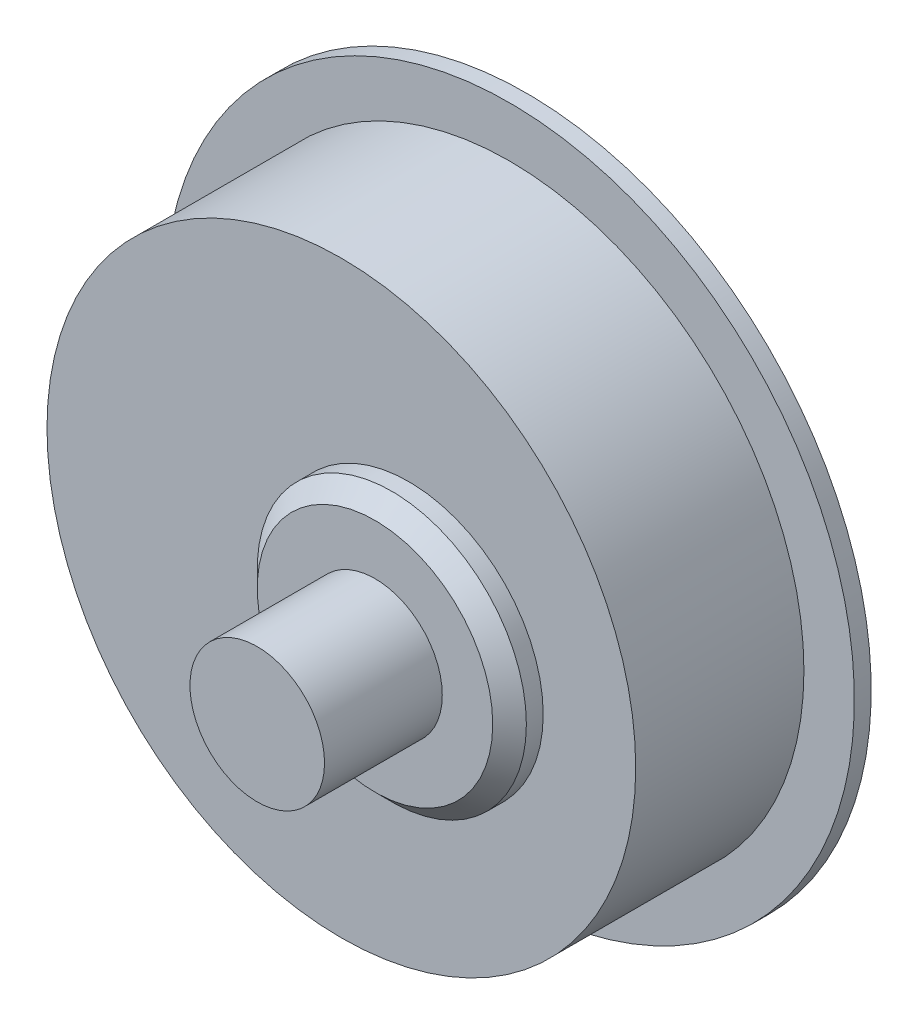
from build123d import *
from build123d.topology import SkipClean

# Parameters (mm, degrees)
SKETCH1_R               = 17.5
BOSS_EXTRUDE1_DEPTH     = 5
SKETCH3_R               = 20.5
SKETCH3_R_2             = 17.5
BOSS_EXTRUDE3_DEPTH     = 1
BOSS_EXTRUDE2_OUTLINE_R = 7.5
BOSS_EXTRUDE2_DEPTH     = 0.5
SKETCH4_R               = 8
BOSS_EXTRUDE5_DEPTH     = 2
BOSS_EXTRUDE6_START     = 7
SKETCH5_R               = 4
BOSS_EXTRUDE6_DEPTH     = 7
CHAMFER1_SIZE           = 1


# Read off the part's stored shape, not the designer's step: Boss-Extrude2
with BuildPart() as part:
    # Sketch1 → Boss-Extrude1 (new, symmetric)
    with BuildSketch(Plane.XY):
        with Locations((-4, 0)):
            Circle(SKETCH1_R)
        with BuildLine():
            Line((1.5, 3.708099244), (1.5, -3.708099244))
            ThreePointArc((1.5, -3.708099244), (-4, 0), (1.5, 3.708099244))
        make_face(mode=Mode.SUBTRACT)
    extrude(amount=BOSS_EXTRUDE1_DEPTH, both=True)

    # Sketch3 → Boss-Extrude3 (add)
    # profile 1 of 2: a face of its own
    with SkipClean():  # the faces are left unmerged after this step: merging them gives an invalid solid
        with BuildSketch(Plane(origin=(0, 0, -5), x_dir=(-1, 0, 0), z_dir=(0, 0, -1))):
            with Locations((4, 0)):
                Circle(SKETCH3_R)
            with Locations(Location((4, 0, 0), (0, 0, 180))):
                Circle(SKETCH3_R_2, mode=Mode.SUBTRACT)
        # profile 2 of 2: a face of its own
        with BuildSketch(Plane(origin=(0, 0, -5), x_dir=(-1, 0, 0), z_dir=(0, 0, -1))):
            with Locations(Location((4, 0, 0), (0, 0, 180))):
                Circle(SKETCH3_R_2)
            with BuildLine():
                Line((-1.5, -3.708099244), (-1.5, 3.708099244))
                ThreePointArc((-1.5, 3.708099244), (4, 0), (-1.5, -3.708099244))
            make_face(mode=Mode.SUBTRACT)
        extrude(amount=BOSS_EXTRUDE3_DEPTH)

    # Boss-Extrude2 outline → Boss-Extrude2 (add)
    with SkipClean():  # the faces are left unmerged after this step: merging them gives an invalid solid
        with BuildSketch(Plane(origin=(0, 0, -6), x_dir=(-1, 0, 0), z_dir=(0, 0, -1))):
            Circle(BOSS_EXTRUDE2_OUTLINE_R)
            with BuildLine():
                ThreePointArc((-1.5, 3.708099244), (4, 0), (-1.5, -3.708099244))
                Line((-1.5, -3.708099244), (-1.5, 3.708099244))
            make_face(mode=Mode.SUBTRACT)
        extrude(amount=BOSS_EXTRUDE2_DEPTH)

    # Sketch4 → Boss-Extrude5 (add)
    with SkipClean():  # the faces are left unmerged after this step: merging them gives an invalid solid
        with BuildSketch(Plane.XY.offset(5)):
            Circle(SKETCH4_R)
        extrude(amount=BOSS_EXTRUDE5_DEPTH)

    # Sketch5 → Boss-Extrude6 (add)
    with SkipClean():  # the faces are left unmerged after this step: merging them gives an invalid solid
        with BuildSketch(Plane.XY.offset(7).offset(BOSS_EXTRUDE6_START)):
            Circle(SKETCH5_R)
        extrude(amount=-BOSS_EXTRUDE6_DEPTH)

    # Chamfer1
    chamfer1_edges = [part.edges().sort_by_distance(p)[0] for p in [
        (-8, 0, 7),
    ]]
    chamfer(chamfer1_edges, length=CHAMFER1_SIZE)


solid = part.part
